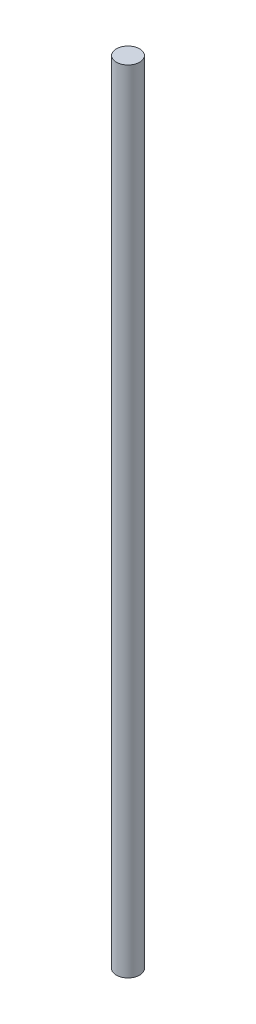
from build123d import *

# Parameters (mm, degrees)
SKETCH1_R           = 12.5
BOSS_EXTRUDE1_DEPTH = 850


with BuildPart() as part:
    # Sketch1 → Boss-Extrude1 (new body)
    with BuildSketch(Plane(origin=(0, 0, 0), x_dir=(1, 0, 0), z_dir=(0, 1, 0))):
        Circle(SKETCH1_R)
    extrude(amount=BOSS_EXTRUDE1_DEPTH)


solid = part.part
